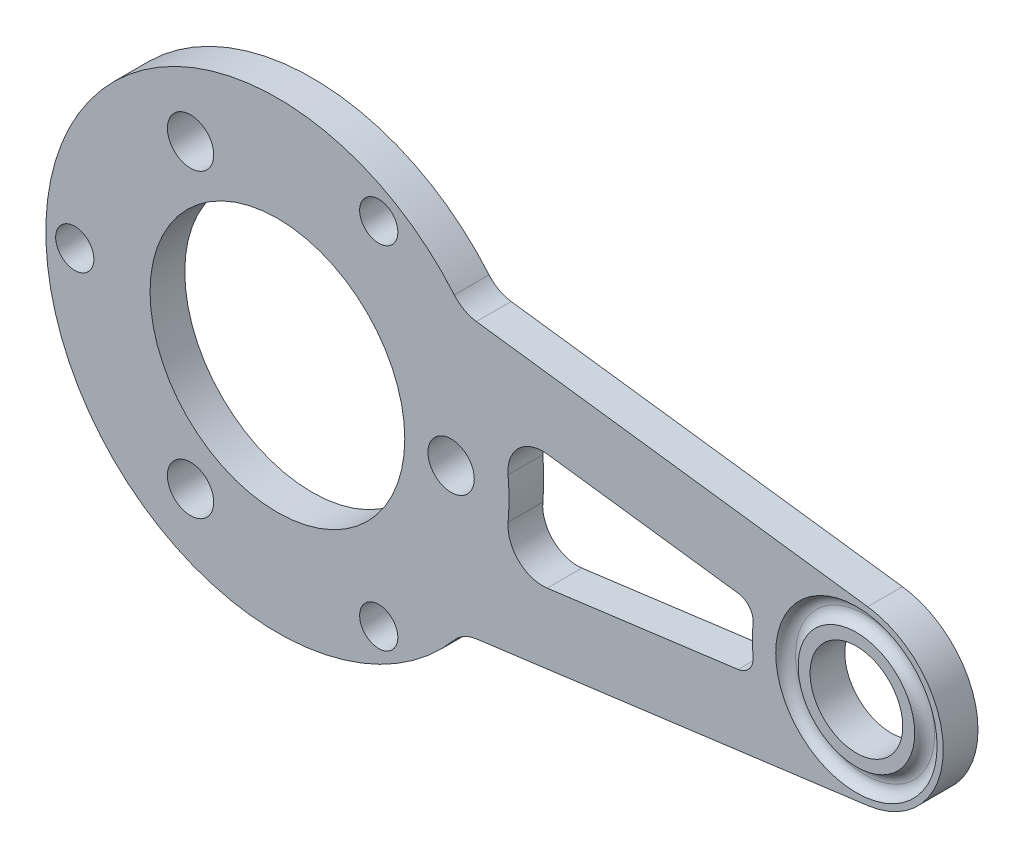
from build123d import *
from build123d.topology import SkipClean

# Parameters (mm, degrees)
SKETCH_1_R          = 1.65
SKETCH_1_R_2        = 5
SKETCH_1_R_3        = 4
EXTRUDE_1_DEPTH     = 3
CUT_EXTRUDE_1_DEPTH = 5
CUT_EXTRUDE_START   = -2
SKETCH_3_R          = 2.55
CUT_EXTRUDE_2_DEPTH = 1
SKETCH_4_R          = 20
EXTRUDE_2_DEPTH     = 3
SKETCH_5_R          = 11
SKETCH_5_R_2        = 1.65
SKETCH_5_R_3        = 2
CUT_EXTRUDE_3_DEPTH = 61.952850631
FILLET_1_R          = 3
SKETCH_8_R          = 7.5
EXTRUDE_4_DEPTH     = 0.25
SKETCH_9_R          = 7
SKETCH_9_R_2        = 5
CUT_EXTRUDE_4_DEPTH = 1
FILLET_2_R          = 1
SKETCH_11_R         = 7.5
CUT_EXTRUDE_6_DEPTH = 0.25


with BuildPart() as part:
    # 草图1 → 凸台-拉伸1 (new body)
    with BuildSketch(Plane.XY):
        with BuildLine():
            Line((1.82, -13.881195914), (50.975, -7.436354954))
            ThreePointArc((50.975, -7.436354954), (57.5, 0), (50.975, 7.436354954))
            Line((50.975, 7.436354954), (1.82, 13.881195914))
            ThreePointArc((1.82, 13.881195914), (-14, 0), (1.82, -13.881195914))
        make_face()
        with Locations((-9, 0)):
            Circle(SKETCH_1_R, mode=Mode.SUBTRACT)
        with Locations((4.5, 7.794228634)):
            Circle(SKETCH_1_R, mode=Mode.SUBTRACT)
        with Locations((4.5, -7.794228634)):
            Circle(SKETCH_1_R, mode=Mode.SUBTRACT)
        Circle(SKETCH_1_R_2, mode=Mode.SUBTRACT)
        with Locations((50, 0)):
            Circle(SKETCH_1_R_3, mode=Mode.SUBTRACT)
    extrude(amount=EXTRUDE_1_DEPTH)

    # 草图2 → 切除-拉伸1 (cut)
    with BuildSketch(Plane.XY.offset(3)):
        with BuildLine():
            Line((16.077054233, -5.960564335), (39.784103065, -2.852270991))
            ThreePointArc((39.784103065, -2.852270991), (40.77864829, -2.278773581), (41.076374055, -1.17))
            ThreePointArc((41.076374055, -1.17), (41, 0), (41.076374055, 1.17))
            ThreePointArc((41.076374055, 1.17), (40.77864829, 2.278773581), (39.784103065, 2.852270991))
            Line((39.784103065, 2.852270991), (16.077054233, 5.960564335))
            ThreePointArc((16.077054233, 5.960564335), (14.747754312, 5.454804266), (14.438231121, 4.066630313))
            ThreePointArc((14.438231121, 4.066630313), (15, 0), (14.438231121, -4.066630313))
            ThreePointArc((14.438231121, -4.066630313), (14.747754312, -5.454804266), (16.077054233, -5.960564335))
        make_face()
    extrude(amount=-CUT_EXTRUDE_1_DEPTH, mode=Mode.SUBTRACT)

    # 草图3 → 切除-拉伸2 (cut)
    with BuildSketch(Plane.XY.offset(3).offset(CUT_EXTRUDE_START)):
        with Locations((-9, 0)):
            Circle(SKETCH_3_R)
        with Locations((4.5, 7.794228634)):
            Circle(SKETCH_3_R)
        with Locations((4.5, -7.794228634)):
            Circle(SKETCH_3_R)
    extrude(amount=-CUT_EXTRUDE_2_DEPTH, mode=Mode.SUBTRACT)

    # 草图4 → 凸台-拉伸2 (add, through all)
    with BuildSketch(Plane.XY.offset(3)):
        Circle(SKETCH_4_R)
    extrude(amount=-EXTRUDE_2_DEPTH)

    # 草图5 → 切除-拉伸3 (cut, through all)
    with BuildSketch(Plane.XY.offset(3)):
        Circle(SKETCH_5_R)
        with Locations((-17.5, 0)):
            Circle(SKETCH_5_R_2)
        with Locations((8.75, 15.155444566)):
            Circle(SKETCH_5_R_2)
        with Locations((8.75, -15.155444566)):
            Circle(SKETCH_5_R_2)
        with Locations((-7.5, 12.990381057)):
            Circle(SKETCH_5_R_3)
        with Locations((15, 0)):
            Circle(SKETCH_5_R_3)
        with Locations((-7.5, -12.990381057)):
            Circle(SKETCH_5_R_3)
    extrude(amount=-CUT_EXTRUDE_3_DEPTH, mode=Mode.SUBTRACT)

    # 圆角1
    fillet_1_edges = [part.edges().sort_by_distance(p)[0] for p in [
        (15.981652446, -12.024424522, 1.5),
        (19.214751718, -5.549172589, 1.5),
        (15.981652446, 12.024424522, 1.5),
        (19.214751718, 5.549172589, 1.5),
    ]]
    fillet(fillet_1_edges, radius=FILLET_1_R)

    # 草图8 → 凸台-拉伸4 (add)
    with SkipClean():  # the faces are left unmerged after this step: merging them gives an invalid solid
        with BuildSketch(Plane(origin=(0, 0, 3), x_dir=(-1, 0, 0), z_dir=(0, 0, -1))):
            with Locations((-50, 0)):
                Circle(SKETCH_8_R)
        extrude(amount=-EXTRUDE_4_DEPTH)

    # 草图9 → 切除-拉伸4 (cut)
    with SkipClean():  # the faces are left unmerged after this step: merging them gives an invalid solid
        with BuildSketch(Plane.XY.offset(3.25)):
            with Locations((50, 0)):
                Circle(SKETCH_9_R)
            with Locations((50, 0)):
                Circle(SKETCH_9_R_2, mode=Mode.SUBTRACT)
        extrude(amount=-CUT_EXTRUDE_4_DEPTH, mode=Mode.SUBTRACT)

    # 圆角2
    fillet_2_edges = [part.edges().sort_by_distance(p)[0] for p in [
        (43, 0, 2.25),
        (45, 0, 2.25),
    ]]
    fillet(fillet_2_edges, radius=FILLET_2_R - 0.0001)  # a hair under: the kernel refuses the full size

    # 草图11 → 切除-拉伸6 (cut)
    with BuildSketch(Plane(origin=(0, 0, 3), x_dir=(-1, 0, 0), z_dir=(0, 0, -1))):
        with Locations((-50, 0)):
            Circle(SKETCH_11_R)
    extrude(amount=-CUT_EXTRUDE_6_DEPTH, mode=Mode.SUBTRACT)


solid = part.part
